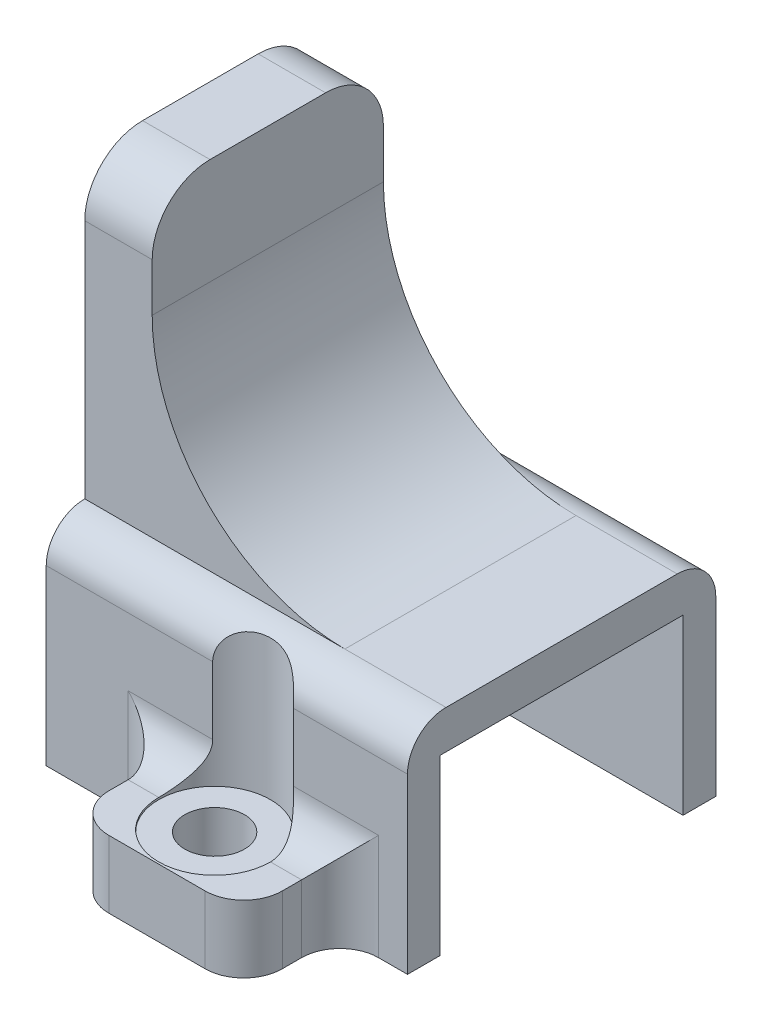
from build123d import *

# Parameters (mm, degrees)
SALIENTE_EXTRUIR1_DEPTH = 10
CORTAR_EXTRUIR1_DEPTH   = 8
CROQUIS3_W              = 9
CROQUIS3_H              = 2.5
SALIENTE_EXTRUIR2_DEPTH = 5
CROQUIS4_R              = 1.5499999999999994
CORTAR_EXTRUIR2_DEPTH   = 2.5
REDONDEO1_R             = 2
CROQUIS5_R              = 2.9
CORTAR_EXTRUIR3_DEPTH   = 7.6
SALIENTE_EXTRUIR3_DEPTH = 15.5
REDONDEO2_R             = 10
REDONDEO3_R             = 3
CROQUIS8_R              = 1.5499999999999994
SALIENTE_EXTRUIR5_DEPTH = 1
CROQUIS9_W              = 5
CROQUIS9_H              = 1.700000000000001
CORTAR_EXTRUIR4_DEPTH   = 36.46565245064583


with BuildPart() as part:
    # Croquis1 → Saliente-Extruir1 (new body)
    with BuildSketch(Plane(origin=(0, 0, 0), x_dir=(1, 0, 0), z_dir=(0, 1, 0))):
        Polygon((0, 0), (18.75, 0), (18.749999999999996, 16), (-3.47e-15, 16), align=None)
    extrude(amount=SALIENTE_EXTRUIR1_DEPTH)

    # Croquis2 → Cortar-Extruir1 (cut)
    with BuildSketch(Plane.XZ):
        Polygon((0, -1.7000000000000002), (18.749999999999993, -1.6999999999999997), (18.749999999999996, -14.3), (1.51e-15, -14.3), align=None)
    extrude(amount=-CORTAR_EXTRUIR1_DEPTH, mode=Mode.SUBTRACT)

    # Croquis3 → Saliente-Extruir2 (add)
    with BuildSketch(Plane.XY):
        with Locations((10.750000000000002, 1.25)):
            Rectangle(CROQUIS3_W, CROQUIS3_H)
    extrude(amount=SALIENTE_EXTRUIR2_DEPTH)

    # Croquis4 → Cortar-Extruir2 (cut)
    with BuildSketch(Plane(origin=(0, 2.5, 0), x_dir=(1, 0, 0), z_dir=(0, 1, 0))):
        with Locations(Location((10.74, -2, 0), (0, 0, 270))):
            Circle(CROQUIS4_R)
    extrude(amount=-CORTAR_EXTRUIR2_DEPTH, mode=Mode.SUBTRACT)

    # Redondeo1
    # the kernel refuses this fillet: 2 mm, written as the material it adds along each edge
    with BuildSketch(Plane(origin=(6.25, 2.5, 0), x_dir=(-1, 0, 0), z_dir=(0, -1, 0))) as redondeo1_piece_1:
        with BuildLine():
            CenterArc((REDONDEO1_R, -REDONDEO1_R), REDONDEO1_R, 90, 90)
            Line((0, -REDONDEO1_R), (0, 0))
            Line((0, 0), (REDONDEO1_R, 0))
        make_face()
    extrude(amount=2.5)
    with BuildSketch(Plane(origin=(15.25, 0, 0), x_dir=(1, 0, 0), z_dir=(0, 1, 0))) as redondeo1_piece_2:
        with BuildLine():
            CenterArc((REDONDEO1_R, -REDONDEO1_R), REDONDEO1_R, 90, 90)
            Line((0, -REDONDEO1_R), (0, 0))
            Line((0, 0), (REDONDEO1_R, 0))
        make_face()
    extrude(amount=2.5)
    with BuildSketch(Plane(origin=(15.25, 2.5, 0), x_dir=(0, 1, 0), z_dir=(-1, 0, 0))) as redondeo1_piece_3_section:
        with BuildLine():
            CenterArc((REDONDEO1_R, -REDONDEO1_R), REDONDEO1_R, 90, 90)
            Line((0, -REDONDEO1_R), (0, 0))
            Line((0, 0), (REDONDEO1_R, 0))
        make_face()
    redondeo1_piece_3 = extrude(amount=9, mode=Mode.PRIVATE)
    redondeo1_piece_3 = redondeo1_piece_3 - Plane(origin=(10.74, 2.981912580650479, 2), x_dir=(-1.8e-16, 0, 1), z_dir=(0, 1, 0)) * Cylinder(1.5499999999999994, 26, mode=Mode.PRIVATE)
    add(redondeo1_piece_3)
    with BuildSketch(Plane(origin=(6.25, 7.5, 0), x_dir=(-1, 0, 0), z_dir=(0, -1, 0))) as redondeo1_piece_4a_section:
        with BuildLine():
            CenterArc((REDONDEO1_R, -REDONDEO1_R), REDONDEO1_R, 90, 90)
            Line((0, -REDONDEO1_R), (0, 0))
            Line((0, 0), (REDONDEO1_R, 0))
        make_face()
    redondeo1_piece_4a = extrude(amount=7.5, mode=Mode.PRIVATE)
    redondeo1_piece_4a = split(redondeo1_piece_4a, bisect_by=Plane(origin=(5.797209771466349, 2.5, 0.45279022853365075), z_dir=(0, 1, 0)), keep=Keep.TOP, mode=Mode.PRIVATE)
    with BuildSketch(Plane(origin=(15.25, 2.5, 0), x_dir=(0, 1, 0), z_dir=(-1, 0, 0))) as redondeo1_piece_4b_section:
        with BuildLine():
            CenterArc((REDONDEO1_R, -REDONDEO1_R), REDONDEO1_R, 90, 90)
            Line((0, -REDONDEO1_R), (0, 0))
            Line((0, 0), (REDONDEO1_R, 0))
        make_face()
    redondeo1_piece_4b = extrude(amount=14, mode=Mode.PRIVATE)
    redondeo1_piece_4b = split(redondeo1_piece_4b, bisect_by=Plane(origin=(6.25, 2.952790228533651, 0.45279022853365075), z_dir=(-1, 0, 0)), keep=Keep.TOP, mode=Mode.PRIVATE)
    redondeo1_piece_4 = redondeo1_piece_4a & redondeo1_piece_4b
    add(redondeo1_piece_4)
    with BuildSketch(Plane(origin=(20.25, 2.5, 0), x_dir=(0, 1, 0), z_dir=(-1, 0, 0))) as redondeo1_piece_5a_section:
        with BuildLine():
            CenterArc((REDONDEO1_R, -REDONDEO1_R), REDONDEO1_R, 90, 90)
            Line((0, -REDONDEO1_R), (0, 0))
            Line((0, 0), (REDONDEO1_R, 0))
        make_face()
    redondeo1_piece_5a = extrude(amount=14, mode=Mode.PRIVATE)
    redondeo1_piece_5a = split(redondeo1_piece_5a, bisect_by=Plane(origin=(18.75, 2.952790228533651, 0.45279022853365036), z_dir=(-1, 0, 2.2e-16)), keep=Keep.TOP, mode=Mode.PRIVATE)
    redondeo1_piece_5a = split(redondeo1_piece_5a, bisect_by=Plane(origin=(15.25, 2.952790228533651, 0.45279022853365075), z_dir=(1, 0, 0)), keep=Keep.TOP, mode=Mode.PRIVATE)
    with BuildSketch(Plane(origin=(15.25, 0, 0), x_dir=(1, 0, 0), z_dir=(0, 1, 0))) as redondeo1_piece_5b_section:
        with BuildLine():
            CenterArc((REDONDEO1_R, -REDONDEO1_R), REDONDEO1_R, 90, 90)
            Line((0, -REDONDEO1_R), (0, 0))
            Line((0, 0), (REDONDEO1_R, 0))
        make_face()
    redondeo1_piece_5b = extrude(amount=7.5, mode=Mode.PRIVATE)
    redondeo1_piece_5b = split(redondeo1_piece_5b, bisect_by=Plane(origin=(15.70279022853365, 2.5, 0.45279022853364964), z_dir=(0, 1, 0)), keep=Keep.TOP, mode=Mode.PRIVATE)
    redondeo1_piece_5 = redondeo1_piece_5a & redondeo1_piece_5b
    add(redondeo1_piece_5)
    # the kernel refuses this fillet: 2 mm, written as the material it takes off along each edge
    with BuildSketch(Plane(origin=(23.749999999999996, 10, -16), x_dir=(0, -1, 0), z_dir=(-1, 0, 0))) as redondeo1_2_piece_1:
        with BuildLine():
            CenterArc((REDONDEO1_R, REDONDEO1_R), REDONDEO1_R, 180, 90)
            Line((0, REDONDEO1_R), (0, 0))
            Line((0, 0), (REDONDEO1_R, 0))
        make_face()
    extrude(amount=28.75, mode=Mode.SUBTRACT)
    with BuildSketch(Plane(origin=(6.25, 7.5, 5), x_dir=(0, 0, -1), z_dir=(0, -1, 0))) as redondeo1_2_piece_2:
        with BuildLine():
            CenterArc((REDONDEO1_R, REDONDEO1_R), REDONDEO1_R, 180, 90)
            Line((0, REDONDEO1_R), (0, 0))
            Line((0, 0), (REDONDEO1_R, 0))
        make_face()
    extrude(amount=12.5, mode=Mode.SUBTRACT)
    with BuildSketch(Plane(origin=(15.25, -5, 5), x_dir=(0, 0, -1), z_dir=(0, 1, 0))) as redondeo1_2_piece_3:
        with BuildLine():
            CenterArc((REDONDEO1_R, REDONDEO1_R), REDONDEO1_R, 180, 90)
            Line((0, REDONDEO1_R), (0, 0))
            Line((0, 0), (REDONDEO1_R, 0))
        make_face()
    extrude(amount=12.5, mode=Mode.SUBTRACT)
    with BuildSketch(Plane(origin=(-5, 10, 0), x_dir=(0, -1, 0), z_dir=(1, 0, 0))) as redondeo1_2_piece_4:
        with BuildLine():
            CenterArc((REDONDEO1_R, REDONDEO1_R), REDONDEO1_R, 180, 90)
            Line((0, REDONDEO1_R), (0, 0))
            Line((0, 0), (REDONDEO1_R, 0))
        make_face()
    extrude(amount=28.75, mode=Mode.SUBTRACT)

    # Croquis5 → Cortar-Extruir3 (cut)
    with BuildSketch(Plane(origin=(0, 10, 0), x_dir=(1, 0, 0), z_dir=(0, 1, 0))):
        with Locations(Location((10.74, -2, 0), (0, 0, 270))):
            Circle(CROQUIS5_R)
    extrude(amount=-CORTAR_EXTRUIR3_DEPTH, mode=Mode.SUBTRACT)

    # Croquis6 → Saliente-Extruir3 (add)
    with BuildSketch(Plane(origin=(0, 10, 0), x_dir=(1, 0, 0), z_dir=(0, 1, 0))):
        Polygon((-3.04e-15, 14), (3.499999999999997, 14), (3.4999999999999982, 2), (-3.04e-15, 2), align=None)
    extrude(amount=SALIENTE_EXTRUIR3_DEPTH)

    # Redondeo2
    # the kernel refuses this fillet: 10 mm, written as the material it adds along each edge
    with BuildSketch(Plane(origin=(3.499999999999997, 10, -14), x_dir=(1, 0, -1.1e-16), z_dir=(1.1e-16, 0, 1))) as redondeo2_piece_1:
        with BuildLine():
            CenterArc((REDONDEO2_R, REDONDEO2_R), REDONDEO2_R, 180, 90)
            Line((-2.22e-15, REDONDEO2_R), (0, 0))
            Line((0, 0), (REDONDEO2_R, 0))
        make_face()
    extrude(amount=12)

    # Redondeo3
    redondeo3_edges = [part.edges().sort_by_distance(p)[0] for p in [
        (1.7499999999999976, 25.5, -2),
        (1.749999999999997, 25.5, -14),
    ]]
    fillet(redondeo3_edges, radius=REDONDEO3_R)

    # Croquis8 → Saliente-Extruir5 (add)
    # profile 1 of 2: a face of its own
    with BuildSketch(Plane.XZ):
        with BuildLine():
            Line((13.25, 5), (8.25, 5))
            ThreePointArc((8.25, 5), (6.835786437626905, 4.414213562373095), (6.25, 3.0000000000000004))
            Line((6.25, 3.0000000000000004), (6.25, 2))
            ThreePointArc((6.25, 2), (5.664213562373095, 0.5857864376269051), (4.25, 0))
            Line((4.25, 0), (-5, 1.08e-15))
            Line((-5, 1.08e-15), (-5, -1.699999999999999))
            Line((-5, -1.699999999999999), (18.749999999999993, -1.6999999999999997))
            Line((18.749999999999993, -1.6999999999999997), (18.75, 0))
            Line((18.75, 0), (17.25, 0))
            ThreePointArc((17.25, 0), (15.835786437626904, 0.5857864376269051), (15.25, 2.0000000000000004))
            Line((15.25, 2.0000000000000004), (15.25, 3))
            ThreePointArc((15.25, 3), (14.664213562373096, 4.414213562373095), (13.25, 5))
        make_face()
        with Locations(Location((10.74, 2, 0), (0, 0, 90))):
            Circle(CROQUIS8_R, mode=Mode.SUBTRACT)
    # profile 2 of 2: a face of its own
    with BuildSketch(Plane.XZ):
        Polygon((18.749999999999996, -14.3), (-5.0000000000000036, -14.299999999999999), (-5.0000000000000036, -16), (18.749999999999996, -16), align=None)
    extrude(amount=SALIENTE_EXTRUIR5_DEPTH)

    # Croquis9 → Cortar-Extruir4 (cut, through all)
    with BuildSketch(Plane(origin=(0, 0, 0), x_dir=(1, 0, 0), z_dir=(0, 1, 0))):
        with Locations((-2.5000000000000036, 15.149999999999999)):
            Rectangle(CROQUIS9_W, CROQUIS9_H)
        Polygon((-5, -1.08e-15), (0, 0), (0, 1.7000000000000002), (-5, 1.699999999999999), align=None)
    extrude(amount=-CORTAR_EXTRUIR4_DEPTH, mode=Mode.SUBTRACT)


solid = part.part
